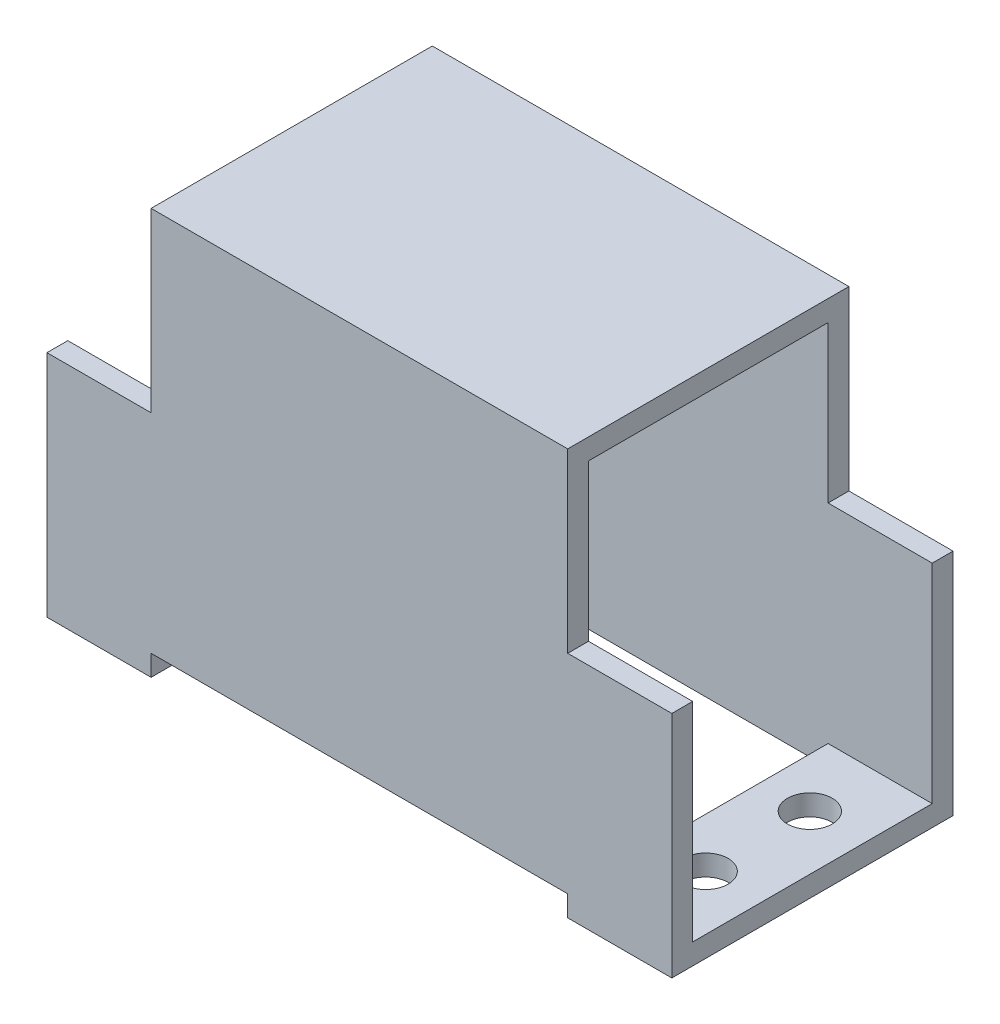
from build123d import *

# Parameters (mm, degrees)
EXTRUDE_1_DEPTH     = 2
SKETCH_3_W          = 10
SKETCH_3_H          = 25
EXTRUDE_2_DEPTH     = 2
EXTRUDE_3_DEPTH     = 2
CUT_EXTRUDE_1_REACH = 54.44
SKETCH_5_R          = 2.15
EXTRUDE_5_DEPTH     = 2


with BuildPart() as part:
    # 草图1 → 凸台-拉伸1 (new body)
    with BuildSketch(Plane.XY):
        Polygon((30, 2.5), (20, 2.5), (20, 17.5), (-20, 17.5), (-20, 2.5), (-30, 2.5), (-30, -17.5), (30, -17.5), align=None)
    extrude(amount=EXTRUDE_1_DEPTH)

    # 草图3 → 凸台-拉伸2 (add)
    with BuildSketch(Plane.XZ.offset(17.5)):
        with Locations((-25, -10.5)):
            Rectangle(SKETCH_3_W, SKETCH_3_H)
        with Locations((25, -10.5)):
            Rectangle(SKETCH_3_W, SKETCH_3_H)
    extrude(amount=EXTRUDE_2_DEPTH)

    # 草图4 → 凸台-拉伸3 (add)
    with BuildSketch(Plane(origin=(0, 0, -23), x_dir=(-1, 0, 0), z_dir=(0, 0, -1))):
        Polygon((30, -19.5), (30, -17.5), (30, 2.5), (20, 2.5), (20, 17.5), (-20, 17.5), (-20, 2.5), (-30, 2.5), (-30, -17.5), (-30, -19.5), align=None)
    extrude(amount=EXTRUDE_3_DEPTH)

    # 草图5 → 切除-拉伸1 (cut, up to next)
    with BuildSketch(Plane(origin=(0, -17.5, 0), x_dir=(1, 0, 0), z_dir=(0, 1, 0)), mode=Mode.PRIVATE) as cut_extrude_1_sk1:
        with Locations((24.75, 16.5)):
            Circle(SKETCH_5_R)
    cut_extrude_1_tool1 = extrude(cut_extrude_1_sk1.sketch, amount=-CUT_EXTRUDE_1_REACH, mode=Mode.PRIVATE) & part.part
    # 草图5 → 切除-拉伸1 (cut, up to next)
    with BuildSketch(Plane(origin=(0, -17.5, 0), x_dir=(1, 0, 0), z_dir=(0, 1, 0)), mode=Mode.PRIVATE) as cut_extrude_1_sk2:
        with Locations((24.75, 6.5)):
            Circle(SKETCH_5_R)
    cut_extrude_1_tool2 = extrude(cut_extrude_1_sk2.sketch, amount=-CUT_EXTRUDE_1_REACH, mode=Mode.PRIVATE) & part.part
    # 草图5 → 切除-拉伸1 (cut, up to next)
    with BuildSketch(Plane(origin=(0, -17.5, 0), x_dir=(1, 0, 0), z_dir=(0, 1, 0)), mode=Mode.PRIVATE) as cut_extrude_1_sk3:
        with Locations((-24.75, 16.5)):
            Circle(SKETCH_5_R)
    cut_extrude_1_tool3 = extrude(cut_extrude_1_sk3.sketch, amount=-CUT_EXTRUDE_1_REACH, mode=Mode.PRIVATE) & part.part
    # 草图5 → 切除-拉伸1 (cut, up to next)
    with BuildSketch(Plane(origin=(0, -17.5, 0), x_dir=(1, 0, 0), z_dir=(0, 1, 0)), mode=Mode.PRIVATE) as cut_extrude_1_sk4:
        with Locations((-24.75, 6.5)):
            Circle(SKETCH_5_R)
    cut_extrude_1_tool4 = extrude(cut_extrude_1_sk4.sketch, amount=-CUT_EXTRUDE_1_REACH, mode=Mode.PRIVATE) & part.part
    add(cut_extrude_1_tool1.solids().sort_by_distance((24.75, -17.5, -16.5))[0], mode=Mode.SUBTRACT)
    add(cut_extrude_1_tool2.solids().sort_by_distance((24.75, -17.5, -6.5))[0], mode=Mode.SUBTRACT)
    add(cut_extrude_1_tool3.solids().sort_by_distance((-24.75, -17.5, -16.5))[0], mode=Mode.SUBTRACT)
    add(cut_extrude_1_tool4.solids().sort_by_distance((-24.75, -17.5, -6.5))[0], mode=Mode.SUBTRACT)

    # 草图6 → 凸台-拉伸5 (add)
    with BuildSketch(Plane(origin=(0, 17.5, 0), x_dir=(1, 0, 0), z_dir=(0, 1, 0))):
        Polygon((-20, 0), (-20, -2), (20, -2), (20, 0), (20, 23), (20, 25), (-20, 25), (-20, 23), align=None)
    extrude(amount=EXTRUDE_5_DEPTH)


solid = part.part
